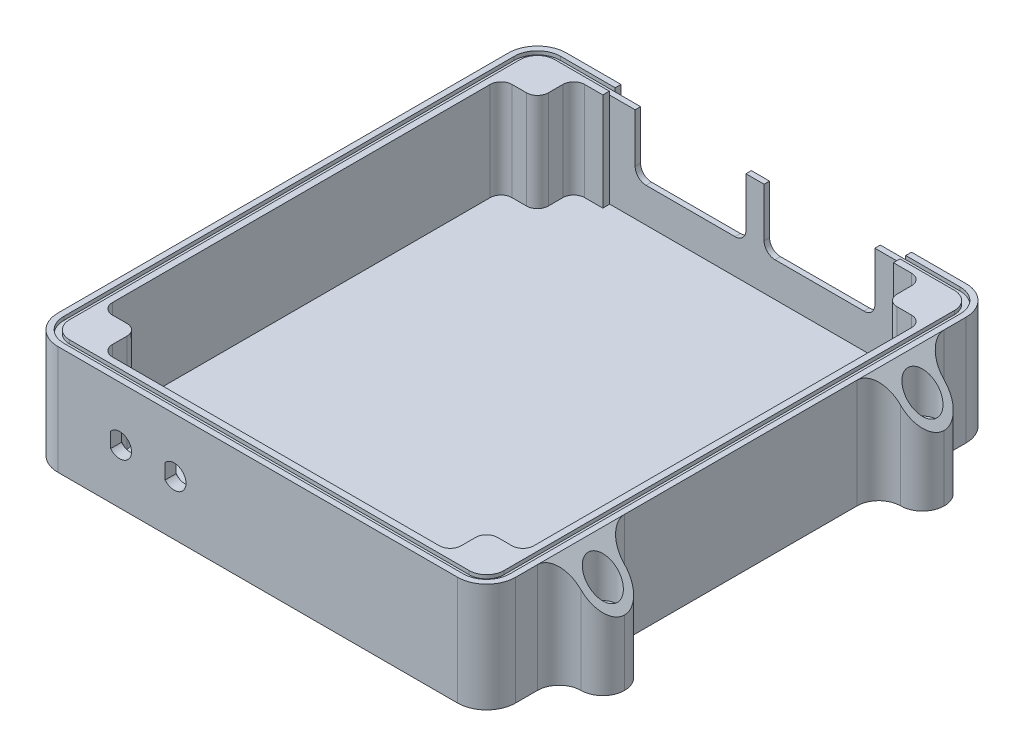
from build123d import *

# Parameters (mm, degrees)
SKETCH1_W                                    = 12
SKETCH1_H                                    = 12
SKETCH1_W_2                                  = 126
SKETCH1_H_2                                  = 140
BOSS_EXTRUDE2_DEPTH                          = 30
CBORE_FOR_M4_HEX_SOCKET_HEAD_CAP_SCR_2_COUNT = 2
CBORE_FOR_M4_HEX_SOCKET_HEAD_CAP_SCR_2_PITCH = 138
CBORE_FOR_M4_HEX_SOCKET_HEAD_CAP_SCR_3_COUNT = 2
CBORE_FOR_M4_HEX_SOCKET_HEAD_CAP_SCR_3_PITCH = 163.670400501
CBORE_FOR_M4_HEX_SOCKET_HEAD_CAP_SCR_4_COUNT = 2
CBORE_FOR_M4_HEX_SOCKET_HEAD_CAP_SCR_4_PITCH = 88
CHAMFER1_SIZE                                = 12
FILLET1_R                                    = 8
FILLET2_R                                    = 6
CUT_EXTRUDE2_DEPTH                           = 27
CUT_EXTRUDE3_DEPTH                           = 1
SKETCH11_W                                   = 80
SKETCH11_H                                   = 25
CUT_EXTRUDE4_DEPTH                           = 1.6
SKETCH12_W                                   = 80
SKETCH12_H                                   = 27
CUT_EXTRUDE5_DEPTH                           = 1.9
CUT_EXTRUDE6_DEPTH                           = 1.9
SKETCH14_R                                   = 6
CUT_EXTRUDE8_DEPTH                           = 2
CUT_EXTRUDE9_DEPTH                           = 3


# Some blends are built 0.0001 mm under size
with BuildPart() as part:
    # Sketch1 → Boss-Extrude2 (new body)
    with BuildSketch(Plane(origin=(0, 0, 0), x_dir=(1, 0, 0), z_dir=(0, 1, 0))):
        with Locations((-69, -44)):
            Rectangle(SKETCH1_W, SKETCH1_H)
        Rectangle(SKETCH1_W_2, SKETCH1_H_2)
        with Locations((-69, 44)):
            Rectangle(SKETCH1_W, SKETCH1_H)
        with Locations((69, 44)):
            Rectangle(SKETCH1_W, SKETCH1_H)
        with Locations((69, -44)):
            Rectangle(SKETCH1_W, SKETCH1_H)
    extrude(amount=BOSS_EXTRUDE2_DEPTH)

    # Sketch3 → CBORE for M4 Hex Socket Head Cap Screw1 (revolve, cut)
    with BuildSketch(Plane(origin=(-69, 30, 44), x_dir=(0, 0, 1), z_dir=(1, 0, 0))):
        Polygon((0, 0), (0, 30), (3, 30), (2.4, 29.4), (2.4, 14.4), (4, 14.4), (4, 0), align=None)
    cbore_for_m4_hex_socket_head_cap_screw1 = revolve(axis=Axis((-69, 36.35, 44), (0, -1, 0)), mode=Mode.SUBTRACT)

    # CBORE for M4 Hex Socket Head Cap Scr 2: CBORE for M4 Hex Socket Head Cap Screw1 ×2
    with Locations(*[(i * CBORE_FOR_M4_HEX_SOCKET_HEAD_CAP_SCR_2_PITCH, 0, 0) for i in range(1, CBORE_FOR_M4_HEX_SOCKET_HEAD_CAP_SCR_2_COUNT)]):
        add(cbore_for_m4_hex_socket_head_cap_screw1, mode=Mode.SUBTRACT)

    # CBORE for M4 Hex Socket Head Cap Scr 3: CBORE for M4 Hex Socket Head Cap Screw1 ×2
    with Locations(*[Vector(0.8431579538999365, 0, -0.537665941617351) * (i * CBORE_FOR_M4_HEX_SOCKET_HEAD_CAP_SCR_3_PITCH) for i in range(1, CBORE_FOR_M4_HEX_SOCKET_HEAD_CAP_SCR_3_COUNT)]):
        add(cbore_for_m4_hex_socket_head_cap_screw1, mode=Mode.SUBTRACT)

    # CBORE for M4 Hex Socket Head Cap Scr 4: CBORE for M4 Hex Socket Head Cap Screw1 ×2
    with Locations(*[(0, 0, -i * CBORE_FOR_M4_HEX_SOCKET_HEAD_CAP_SCR_4_PITCH) for i in range(1, CBORE_FOR_M4_HEX_SOCKET_HEAD_CAP_SCR_4_COUNT)]):
        add(cbore_for_m4_hex_socket_head_cap_screw1, mode=Mode.SUBTRACT)

    # Chamfer1
    # the kernel refuses this chamfer: 12 mm, written as the material it takes off along each edge
    with BuildSketch(Plane(origin=(-75, 30, 7.139804144), x_dir=(0.9996219169112969, 0.027495876610586497, 0), z_dir=(0, 0, 1)), Plane(origin=(-75, 30, -80.860195856), x_dir=(0.9996219169112969, 0.027495876610586497, 0), z_dir=(0, 0, 1)), Plane(origin=(75, 30, -7.139804144), x_dir=(-0.9996219169112969, 0.027495876610586497, 0), z_dir=(0, 0, -1)), Plane(origin=(75, 30, 80.860195856), x_dir=(-0.9996219169112969, 0.027495876610586497, 0), z_dir=(0, 0, -1))) as chamfer1_piece_1:
        Polygon((CHAMFER1_SIZE * 0.999621916911, -CHAMFER1_SIZE * 0.0274958766106), (-CHAMFER1_SIZE * 0.0274958766106, -CHAMFER1_SIZE * 0.999621916911), (0, 0), align=None)
    extrude(amount=73.720391711, mode=Mode.SUBTRACT)

    # Fillet1
    fillet1_edges = [part.edges().sort_by_distance(p)[0] for p in [
        (-63, 15, -70),
        (63, 15, -70),
        (63, 15, 70),
        (-63, 15, 70),
    ]]
    fillet(fillet1_edges, radius=FILLET1_R)

    # Fillet2
    fillet2_edges = [part.edges().sort_by_distance(p)[0] for p in [
        (-63, 15, 38),
        (-63, 15, -38),
        (-63, 15, -50),
        (63, 15, -50),
        (63, 15, -38),
        (63, 15, 38),
        (63, 15, 50),
        (-63, 15, 50),
        (-75, 9, 50),
        (-75, 9, 38),
        (-75, 9, -38),
        (-75, 9, -50),
        (75, 9, -50),
        (75, 9, -38),
        (75, 9, 38),
        (75, 9, 50),
    ]]
    fillet(fillet2_edges, radius=FILLET2_R - 0.0001)  # a hair under: the kernel refuses the full size

    # Sketch6 → Cut-Extrude2 (cut)
    with BuildSketch(Plane(origin=(0, 30, 0), x_dir=(1, 0, 0), z_dir=(0, 1, 0))):
        with BuildLine():
            Line((-58, 52), (-58, -52))
            ThreePointArc((-58, -52), (-57.121320344, -54.121320344), (-55, -55))
            Line((-55, -55), (-51, -55))
            ThreePointArc((-51, -55), (-48.878679656, -55.878679656), (-48, -58))
            Line((-48, -58), (-48, -62))
            ThreePointArc((-48, -62), (-47.121320344, -64.121320344), (-45, -65))
            Line((-45, -65), (45, -65))
            ThreePointArc((45, -65), (47.121320344, -64.121320344), (48, -62))
            Line((48, -62), (48, -58))
            ThreePointArc((48, -58), (48.878679656, -55.878679656), (51, -55))
            Line((51, -55), (55, -55))
            ThreePointArc((55, -55), (57.121320344, -54.121320344), (58, -52))
            Line((58, -52), (58, 52))
            ThreePointArc((58, 52), (57.121320344, 54.121320344), (55, 55))
            Line((55, 55), (51, 55))
            ThreePointArc((51, 55), (48.878679656, 55.878679656), (48, 58))
            Line((48, 58), (48, 62))
            ThreePointArc((48, 62), (47.121320344, 64.121320344), (45, 65))
            Line((45, 65), (-45, 65))
            ThreePointArc((-45, 65), (-47.121320344, 64.121320344), (-48, 62))
            Line((-48, 62), (-48, 58))
            ThreePointArc((-48, 58), (-48.878679656, 55.878679656), (-51, 55))
            Line((-51, 55), (-55, 55))
            ThreePointArc((-55, 55), (-57.121320344, 54.121320344), (-58, 52))
        make_face()
    extrude(amount=-CUT_EXTRUDE2_DEPTH, mode=Mode.SUBTRACT)

    # Sketch7 → Cut-Extrude3 (cut)
    with BuildSketch(Plane(origin=(0, 30, 0), x_dir=(1, 0, 0), z_dir=(0, 1, 0))):
        with BuildLine():
            Line((55, 68.4), (-55, 68.4))
            ThreePointArc((-55, 68.4), (-59.5254834, 66.5254834), (-61.4, 62))
            Line((-61.4, 62), (-61.4, 56))
            Line((-61.4, 56), (-61.4, 32))
            Line((-61.4, 32), (-61.4, -32))
            Line((-61.4, -32), (-61.4, -56))
            Line((-61.4, -56), (-61.4, -62))
            ThreePointArc((-61.4, -62), (-59.5254834, -66.5254834), (-55, -68.4))
            Line((-55, -68.4), (55, -68.4))
            ThreePointArc((55, -68.4), (59.5254834, -66.5254834), (61.4, -62))
            Line((61.4, -62), (61.4, -56))
            Line((61.4, -56), (61.4, -32))
            Line((61.4, -32), (61.4, 32))
            Line((61.4, 32), (61.4, 56))
            Line((61.4, 56), (61.4, 62))
            ThreePointArc((61.4, 62), (59.5254834, 66.5254834), (55, 68.4))
        make_face()
        with BuildLine():
            Line((55, 66.8), (-55, 66.8))
            ThreePointArc((-55, 66.8), (-58.39411255, 65.39411255), (-59.8, 62))
            Line((-59.8, 62), (-59.8, 56))
            Line((-59.8, 56), (-59.8, 32))
            Line((-59.8, 32), (-59.8, -32))
            Line((-59.8, -32), (-59.8, -56))
            Line((-59.8, -56), (-59.8, -62))
            ThreePointArc((-59.8, -62), (-58.39411255, -65.39411255), (-55, -66.8))
            Line((-55, -66.8), (55, -66.8))
            ThreePointArc((55, -66.8), (58.39411255, -65.39411255), (59.8, -62))
            Line((59.8, -62), (59.8, -56))
            Line((59.8, -56), (59.8, -32))
            Line((59.8, -32), (59.8, 32))
            Line((59.8, 32), (59.8, 56))
            Line((59.8, 56), (59.8, 62))
            ThreePointArc((59.8, 62), (58.39411255, 65.39411255), (55, 66.8))
        make_face(mode=Mode.SUBTRACT)
    extrude(amount=-CUT_EXTRUDE3_DEPTH, mode=Mode.SUBTRACT)

    # Sketch11 → Cut-Extrude4 (cut)
    with BuildSketch(Plane(origin=(0, 0, -70), x_dir=(-1, 0, 0), z_dir=(0, 0, -1))):
        with Locations((0, 17.5)):
            Rectangle(SKETCH11_W, SKETCH11_H)
    extrude(amount=-CUT_EXTRUDE4_DEPTH, mode=Mode.SUBTRACT)

    # Sketch12 → Cut-Extrude5 (cut)
    with BuildSketch(Plane.XY.offset(-65)):
        with Locations((0, 16.5)):
            Rectangle(SKETCH12_W, SKETCH12_H)
    extrude(amount=-CUT_EXTRUDE5_DEPTH, mode=Mode.SUBTRACT)

    # Sketch13 → Cut-Extrude6 (cut)
    with BuildSketch(Plane.XY.offset(-66.9)):
        with BuildLine():
            Line((-33, 29), (-2.5, 29))
            Line((-2.5, 29), (-2.5, 15.5))
            ThreePointArc((-2.5, 15.5), (-3.378679656, 13.378679656), (-5.5, 12.5))
            Line((-5.5, 12.5), (-30, 12.5))
            ThreePointArc((-30, 12.5), (-32.121320344, 13.378679656), (-33, 15.5))
            Line((-33, 15.5), (-33, 29))
        make_face()
        with BuildLine():
            Line((30, 12.5), (5.5, 12.5))
            ThreePointArc((5.5, 12.5), (3.378679656, 13.378679656), (2.5, 15.5))
            Line((2.5, 15.5), (2.5, 29))
            Line((2.5, 29), (33, 29))
            Line((33, 29), (33, 15.5))
            ThreePointArc((33, 15.5), (32.121320344, 13.378679656), (30, 12.5))
        make_face()
    extrude(amount=-CUT_EXTRUDE6_DEPTH, mode=Mode.SUBTRACT)

    # Sketch14 → Cut-Extrude8 (cut)
    with BuildSketch(Plane(origin=(0, 0, 65), x_dir=(-1, 0, 0), z_dir=(0, 0, -1))):
        with Locations((38, 15)):
            Circle(SKETCH14_R)
        with Locations((23, 15)):
            Circle(SKETCH14_R)
    extrude(amount=-CUT_EXTRUDE8_DEPTH, mode=Mode.SUBTRACT)

    # Sketch16 → Cut-Extrude9 (cut)
    with BuildSketch(Plane(origin=(0, 0, 67), x_dir=(-1, 0, 0), z_dir=(0, 0, -1))):
        with BuildLine():
            Line((40.5, 12.923344034), (40.5, 17.076655966))
            ThreePointArc((40.5, 17.076655966), (34.75, 15), (40.5, 12.923344034))
        make_face()
        with BuildLine():
            Line((25.5, 12.923344034), (25.5, 17.076655966))
            ThreePointArc((25.5, 17.076655966), (19.75, 15), (25.5, 12.923344034))
        make_face()
    extrude(amount=-CUT_EXTRUDE9_DEPTH, mode=Mode.SUBTRACT)


solid = part.part
